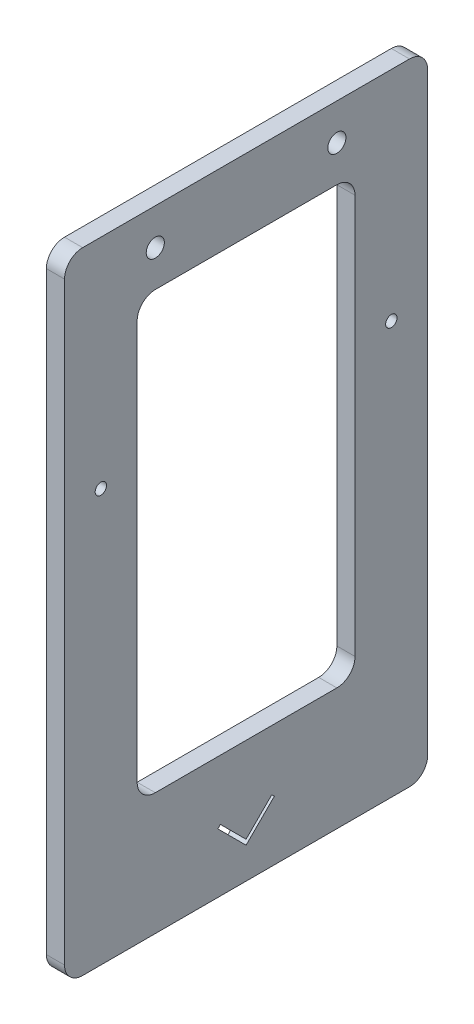
from build123d import *

# Parameters (mm, degrees)
BOSS_EXTRUDE2_DEPTH     = 6.35
CUT_EXTRUDE1_REACH      = 129.376
CUT_EXTRUDE2_DEPTH      = 128.37561853
CUT_EXTRUDE2_DEPTH_BACK = 128.37561853
SKETCH5_R               = 3.175
SKETCH6_R               = 1.984375
CUT_EXTRUDE3_DEPTH      = 128.37561853


with BuildPart() as part:
    # Sketch3 → Boss-Extrude2 (new body)
    with BuildSketch(Plane(origin=(0, 0, 0), x_dir=(0, 0, -1), z_dir=(1, 0, 0))):
        with BuildLine():
            Line((-57.15, -110.236), (57.15, -110.236))
            ThreePointArc((57.15, -110.236), (61.640128061, -108.376128061), (63.5, -103.886))
            Line((63.5, -103.886), (63.5, 103.886))
            ThreePointArc((63.5, 103.886), (61.640128061, 108.376128061), (57.15, 110.236))
            Line((57.15, 110.236), (-57.15, 110.236))
            ThreePointArc((-57.15, 110.236), (-61.640128061, 108.376128061), (-63.5, 103.886))
            Line((-63.5, 103.886), (-63.5, -103.886))
            ThreePointArc((-63.5, -103.886), (-61.640128061, -108.376128061), (-57.15, -110.236))
        make_face()
        with BuildLine():
            Line((-31.75, -67.564), (31.75, -67.564))
            ThreePointArc((31.75, -67.564), (36.240128061, -65.704128061), (38.1, -61.214))
            Line((38.1, -61.214), (38.1, 78.486))
            ThreePointArc((38.1, 78.486), (36.240128061, 82.976128061), (31.75, 84.836))
            Line((31.75, 84.836), (-31.75, 84.836))
            ThreePointArc((-31.75, 84.836), (-36.240128061, 82.976128061), (-38.1, 78.486))
            Line((-38.1, 78.486), (-38.1, -61.214))
            ThreePointArc((-38.1, -61.214), (-36.240128061, -65.704128061), (-31.75, -67.564))
        make_face(mode=Mode.SUBTRACT)
    extrude(amount=BOSS_EXTRUDE2_DEPTH)

    # Sketch4 → Cut-Extrude1 (cut, up to next)
    with BuildSketch(Plane(origin=(6.35, 0, 0), x_dir=(0, 0, -1), z_dir=(1, 0, 0)), mode=Mode.PRIVATE) as cut_extrude1_sk1:
        Polygon((0, -97.536), (-8.980256121, -88.555743879), (-9.878281733, -89.453769491), (0, -99.332051224), (9.878281733, -89.453769491), (8.980256121, -88.555743879), align=None)
    cut_extrude1_tool1 = extrude(cut_extrude1_sk1.sketch, amount=-CUT_EXTRUDE1_REACH, mode=Mode.PRIVATE) & part.part
    add(cut_extrude1_tool1.solids().sort_by_distance((6.35, -93.205002, 4.649259))[0], mode=Mode.SUBTRACT)

    # Sketch5 → Cut-Extrude2 (cut, two sides: drawn at the far end of the back side and taken through both)
    with BuildSketch(Plane(origin=(6.35, 0, 0), x_dir=(0, 0, -1), z_dir=(1, 0, 0)).offset(-CUT_EXTRUDE2_DEPTH_BACK)):
        with Locations((-31.75, 97.536)):
            Circle(SKETCH5_R)
        with Locations((31.75, 97.536)):
            Circle(SKETCH5_R)
    extrude(amount=CUT_EXTRUDE2_DEPTH + CUT_EXTRUDE2_DEPTH_BACK, mode=Mode.SUBTRACT)

    # Sketch6 → Cut-Extrude3 (cut, through all)
    with BuildSketch(Plane(origin=(6.35, 0, 0), x_dir=(0, 0, -1), z_dir=(1, 0, 0))):
        with Locations((-50.8, 34.036)):
            Circle(SKETCH6_R)
        with Locations((50.8, 34.036)):
            Circle(SKETCH6_R)
    extrude(amount=-CUT_EXTRUDE3_DEPTH, mode=Mode.SUBTRACT)


solid = part.part
